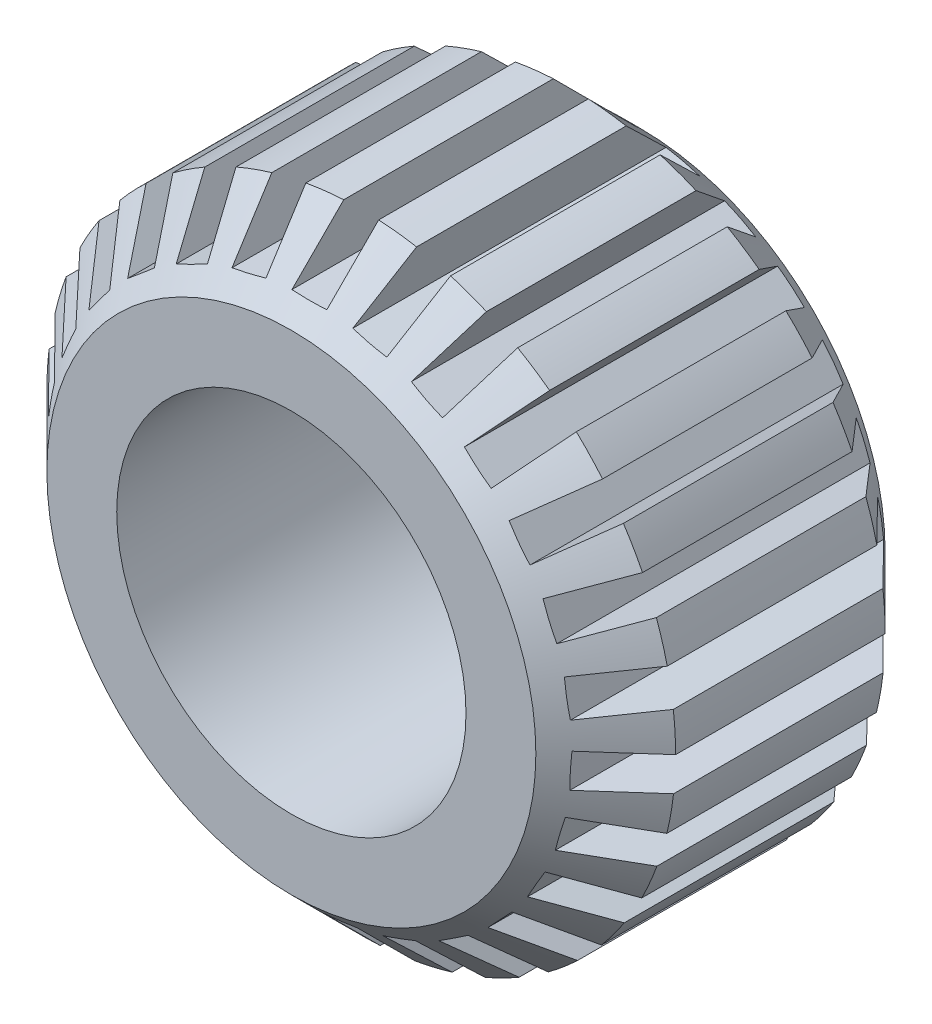
from build123d import *

# Parameters (mm, degrees)
SKETCH2_R           = 9
SKETCH2_R_2         = 5
BOSS_EXTRUDE1_DEPTH = 10
CHAMFER1_SIZE       = 2
CUT_EXTRUDE1_DEPTH  = 17.186414056
CIRPATTERN1_COUNT   = 27


with BuildPart() as part:
    # Sketch2 → Boss-Extrude1 (new body)
    with BuildSketch(Plane.XY):
        Circle(SKETCH2_R)
        Circle(SKETCH2_R_2, mode=Mode.SUBTRACT)
    extrude(amount=BOSS_EXTRUDE1_DEPTH)

    # Chamfer1
    chamfer1_edges = [part.edges().sort_by_distance(p)[0] for p in [
        (-9, 0, 0),
        (-9, 0, 10),
    ]]
    chamfer(chamfer1_edges, length=CHAMFER1_SIZE)

    # Sketch5 → Cut-Extrude1 (cut, symmetric)
    with BuildSketch(Plane.XY.offset(10)):
        with BuildLine():
            ThreePointArc((0.5, 8.986100378), (0, 9), (-0.5, 8.986100378))
            Line((-0.5, 8.986100378), (-0.5, 7.5))
            Line((-0.5, 7.5), (0.5, 7.5))
            Line((0.5, 7.5), (0.5, 8.986100378))
        make_face()
    cut_extrude1 = extrude(amount=CUT_EXTRUDE1_DEPTH, both=True, mode=Mode.SUBTRACT)

    # CirPattern1: Cut-Extrude1 ×27 about axis
    cirpattern1_axis = Axis((0, 0, 10), (0, 0, -1))
    for i in range(1, CIRPATTERN1_COUNT):
        add(cut_extrude1.rotate(cirpattern1_axis, i * 360 / CIRPATTERN1_COUNT), mode=Mode.SUBTRACT)


solid = part.part
